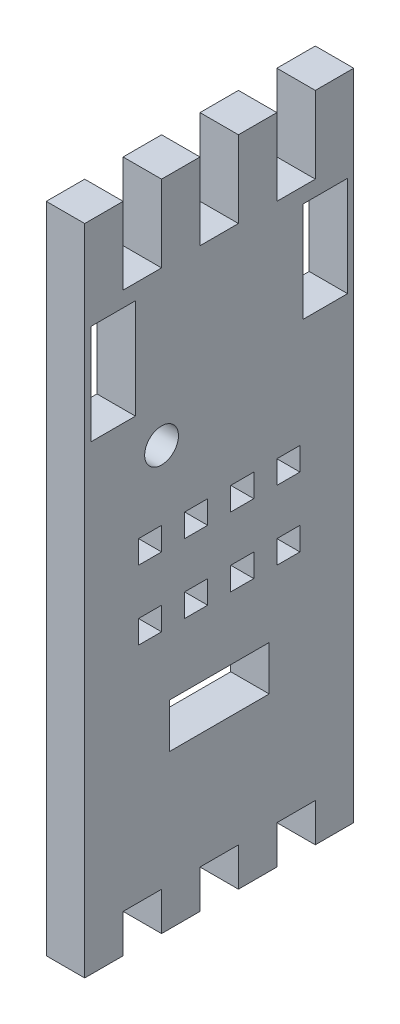
from build123d import *

# Parameters (mm, degrees)
BOSS_EXTRU_1_OUTLINE_R  = 2.2
BOSS_EXTRU_1_DEPTH      = 5
ESQUISSE3_W             = 5
ESQUISSE3_H             = 5
BOSS_EXTRU_3_DEPTH      = 5
ESQUISSE4_W             = 3
ESQUISSE4_H             = 3
ENL_V_MAT_EXTRU_1_DEPTH = 10
ESQUISSE6_W             = 13
ESQUISSE6_H             = 5.8
ENL_V_MAT_EXTRU_2_DEPTH = 10
ESQUISSE7_W             = 5.8
ESQUISSE7_H             = 13
ENL_V_MAT_EXTRU_3_DEPTH = 10


# Read off the part's stored shape, not the designer's step: Boss.-Extru.1
with BuildPart() as part:
    # Boss.-Extru.1 outline → Boss.-Extru.1 (new body)
    with BuildSketch(Plane(origin=(0, 0, 0), x_dir=(0, 0, -1), z_dir=(1, 0, 0))):
        Polygon((-12.5, 40.000001465), (-17.5, 40.000001465), (-17.5, -40.000001465), (-12.5, -40.000001465), (-12.5, -35.000001465), (-7.5, -35.000001465), (-7.5, -40.000001465), (-2.5, -40.000001465), (-2.5, -35.000001465), (2.5, -35.000001465), (2.5, -40.000001465), (7.5, -40.000001465), (7.5, -35.000001465), (12.5, -35.000001465), (12.5, -40.000001465), (17.5, -40.000001465), (17.5, 40.000001465), (12.5, 40.000001465), (12.5, 35.000001047), (7.5, 35.000000628), (7.5, 40.000001465), (2.5, 40.000001465), (2.5, 35.000000209), (-2.5, 34.999999791), (-2.5, 40.000001465), (-7.5, 40.000001465), (-7.5, 34.999999372), (-12.5, 34.999998953), align=None)
        with Locations((-7.5, 14.999999372)):
            Circle(BOSS_EXTRU_1_OUTLINE_R, mode=Mode.SUBTRACT)
    extrude(amount=BOSS_EXTRU_1_DEPTH)

    # Esquisse3 → Boss.-Extru.3 (add)
    with BuildSketch(Plane(origin=(0, 40.000001465, 0), x_dir=(1, 0, 0), z_dir=(0, 1, 0))):
        with Locations((2.5, -15)):
            Rectangle(ESQUISSE3_W, ESQUISSE3_H)
        with Locations((2.5, -5)):
            Rectangle(ESQUISSE3_W, ESQUISSE3_H)
        with Locations((2.5, 5)):
            Rectangle(ESQUISSE3_W, ESQUISSE3_H)
        with Locations((2.5, 15)):
            Rectangle(ESQUISSE3_W, ESQUISSE3_H)
    extrude(amount=BOSS_EXTRU_3_DEPTH)

    # Esquisse4 → Enlèv. mat.-Extru.1 (cut)
    with BuildSketch(Plane.ZY):
        with Locations((-3, -4.5)):
            Rectangle(ESQUISSE4_W, ESQUISSE4_H)
        with Locations((-9, -4.5)):
            Rectangle(ESQUISSE4_W, ESQUISSE4_H)
        with Locations((3, -4.5)):
            Rectangle(ESQUISSE4_W, ESQUISSE4_H)
        with Locations((9, -4.5)):
            Rectangle(ESQUISSE4_W, ESQUISSE4_H)
        with Locations((9, 4.5)):
            Rectangle(ESQUISSE4_W, ESQUISSE4_H)
        with Locations((3, 4.5)):
            Rectangle(ESQUISSE4_W, ESQUISSE4_H)
        with Locations((-3, 4.5)):
            Rectangle(ESQUISSE4_W, ESQUISSE4_H)
        with Locations((-9, 4.5)):
            Rectangle(ESQUISSE4_W, ESQUISSE4_H)
    extrude(amount=-ENL_V_MAT_EXTRU_1_DEPTH, mode=Mode.SUBTRACT)

    # Esquisse6 → Enlèv. mat.-Extru.2 (cut)
    with BuildSketch(Plane.ZY):
        with Locations((0, -17.1)):
            Rectangle(ESQUISSE6_W, ESQUISSE6_H)
    extrude(amount=-ENL_V_MAT_EXTRU_2_DEPTH, mode=Mode.SUBTRACT)

    # Esquisse7 → Enlèv. mat.-Extru.3 (cut)
    with BuildSketch(Plane.ZY):
        with Locations((-13.8, 26.5)):
            Rectangle(ESQUISSE7_W, ESQUISSE7_H)
        with Locations((13.8, 26.5)):
            Rectangle(ESQUISSE7_W, ESQUISSE7_H)
    extrude(amount=-ENL_V_MAT_EXTRU_3_DEPTH, mode=Mode.SUBTRACT)


solid = part.part
